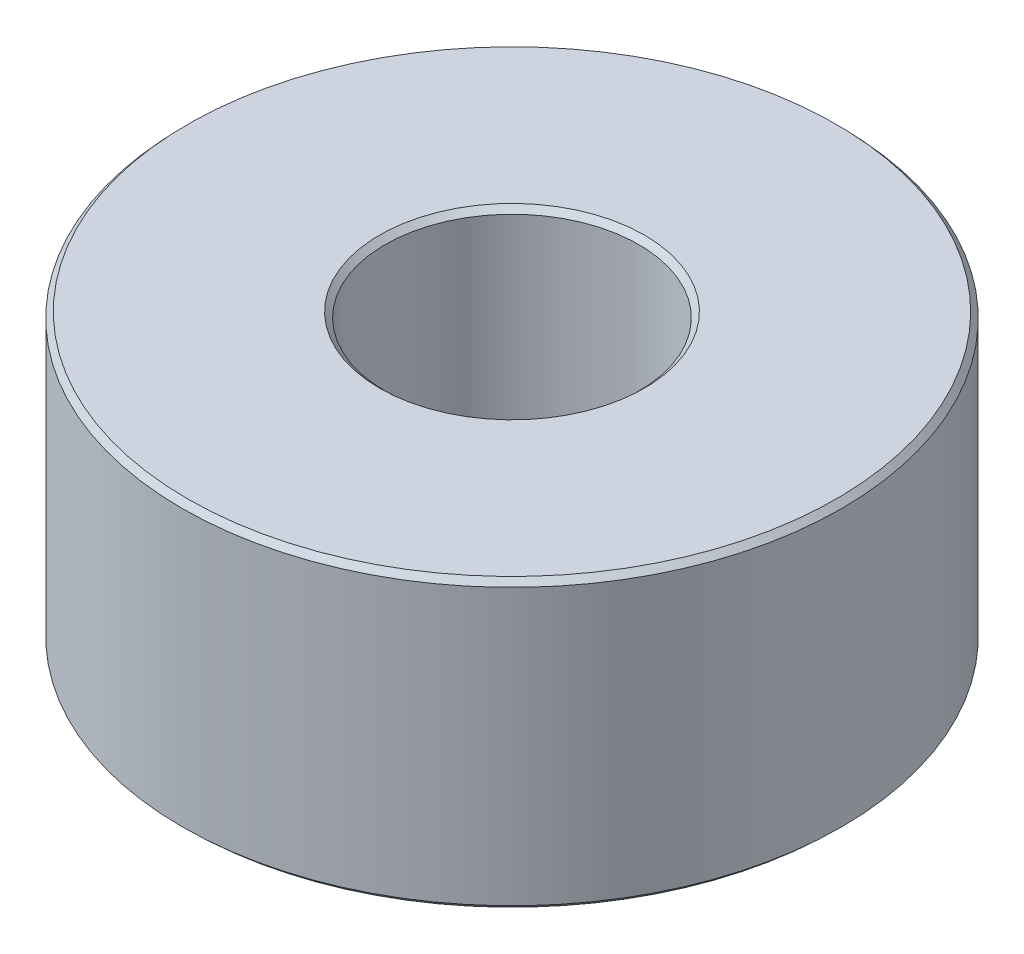
from build123d import *
from OCP.BRepFilletAPI import BRepFilletAPI_MakeChamfer

# Parameters (mm, degrees)
SKETCH1_R           = 42.5
BOSS_EXTRUDE1_DEPTH = 36.961612446
SKETCH2_R           = 16.353422732
CUT_EXTRUDE1_DEPTH  = 71.559625811
CHAMFER1_SIZE       = 0.733065742
CHAMFER1_SIZE2      = 0.688716307


with BuildPart() as part:
    # Sketch1 → Boss-Extrude1 (new body)
    with BuildSketch(Plane(origin=(0, 0, 0), x_dir=(1, 0, 0), z_dir=(0, 1, 0))):
        Circle(SKETCH1_R)
    extrude(amount=BOSS_EXTRUDE1_DEPTH)

    # Sketch2 → Cut-Extrude1 (cut, through all)
    with BuildSketch(Plane(origin=(0, 0, 0), x_dir=(1, 0, 0), z_dir=(0, 1, 0))):
        Circle(SKETCH2_R)
    extrude(amount=CUT_EXTRUDE1_DEPTH, mode=Mode.SUBTRACT)

    # Chamfer1: one chamfer whose edges measure the first distance from different faces: ONE call of the kernel's chamfer builder (chamfer() names one face for all edges)
    chamfer1_edges_1 = [part.edges().sort_by_distance(p)[0] for p in [
        (-16.353422732, 36.961612446, 0),
    ]]
    chamfer1_side_1 = [part.faces().sort_by_distance(p)[0] for p in [
        (-41.297918472, 36.961612446, 0),
    ]]
    chamfer1_edges_2 = [part.edges().sort_by_distance(p)[0] for p in [
        (-16.353422732, 0, 0),
    ]]
    chamfer1_side_2 = [part.faces().sort_by_distance(p)[0] for p in [
        (-16.353422732, 18.480806223, 0),
    ]]
    chamfer1_edges_3 = [part.edges().sort_by_distance(p)[0] for p in [
        (-42.5, 0, 0),
    ]]
    chamfer1_side_3 = [part.faces().sort_by_distance(p)[0] for p in [
        (-41.297918472, 0, 0),
    ]]
    chamfer1_edges_4 = [part.edges().sort_by_distance(p)[0] for p in [
        (-42.5, 36.961612446, 0),
    ]]
    chamfer1_side_4 = [part.faces().sort_by_distance(p)[0] for p in [
        (-42.5, 18.480806223, 0),
    ]]
    chamfer1 = BRepFilletAPI_MakeChamfer(part.part.solid().wrapped)
    for e in chamfer1_edges_1:
        chamfer1.Add(CHAMFER1_SIZE, CHAMFER1_SIZE2, e.wrapped, chamfer1_side_1[0].wrapped)  # the first distance lies on this face
    for e in chamfer1_edges_2:
        chamfer1.Add(CHAMFER1_SIZE, CHAMFER1_SIZE2, e.wrapped, chamfer1_side_2[0].wrapped)  # the first distance lies on this face
    for e in chamfer1_edges_3:
        chamfer1.Add(CHAMFER1_SIZE, CHAMFER1_SIZE2, e.wrapped, chamfer1_side_3[0].wrapped)  # the first distance lies on this face
    for e in chamfer1_edges_4:
        chamfer1.Add(CHAMFER1_SIZE, CHAMFER1_SIZE2, e.wrapped, chamfer1_side_4[0].wrapped)  # the first distance lies on this face
    add(Compound.cast(chamfer1.Shape()), mode=Mode.REPLACE)


solid = part.part
